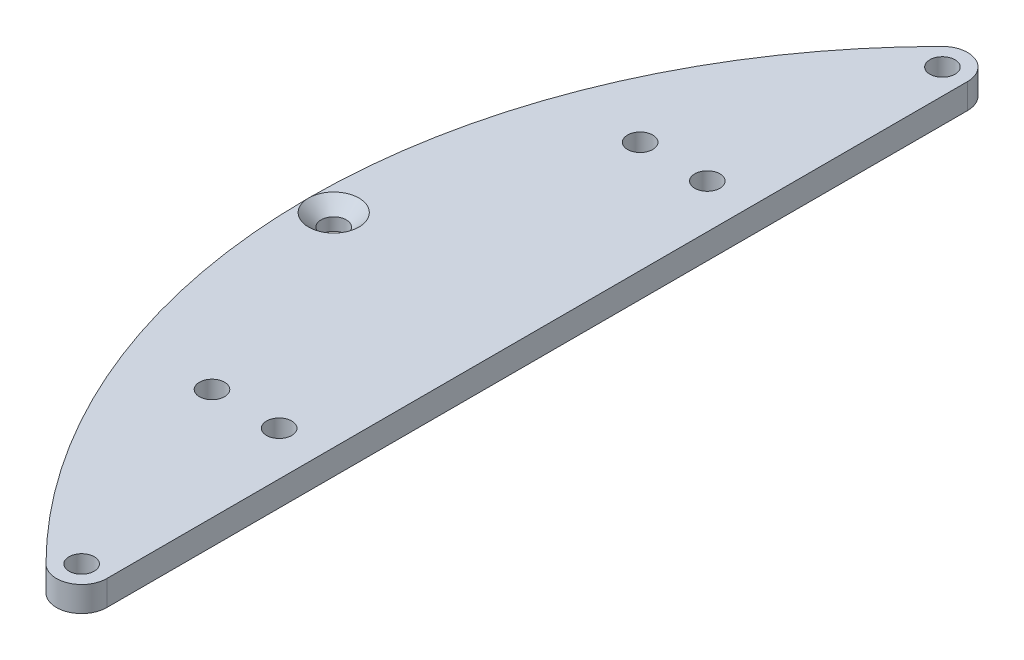
from build123d import *

# Parameters (mm, degrees)
SKETCH_1_R      = 1.5
EXTRUDE_1_DEPTH = 3
CHAMFER_1_SIZE  = 1.5


with BuildPart() as part:
    # 草图1 → 凸台-拉伸1 (new body)
    with BuildSketch(Plane(origin=(0, 0, 0), x_dir=(1, 0, 0), z_dir=(0, 1, 0))):
        with BuildLine():
            Line((-48.265241636, 51.265241636), (-48.265241636, -51.265241636))
            ThreePointArc((-48.265241636, -51.265241636), (-50.117191339, -54.036880234), (-53.38656198, -53.38656198))
            ThreePointArc((-53.38656198, -53.38656198), (-75.5, 0), (-53.38656198, 53.38656198))
            ThreePointArc((-53.38656198, 53.38656198), (-50.117191339, 54.036880234), (-48.265241636, 51.265241636))
        make_face()
        with Locations(Location((-51.265241636, -51.265241636, 0), (0, 0, 270))):
            Circle(SKETCH_1_R, mode=Mode.SUBTRACT)
        with Locations(Location((-72.5, 0, 0), (0, 0, 270))):
            Circle(SKETCH_1_R, mode=Mode.SUBTRACT)
        with Locations(Location((-51.265241636, 51.265241636, 0), (0, 0, 270))):
            Circle(SKETCH_1_R, mode=Mode.SUBTRACT)
        with Locations(Location((-61.499999084, -25.5, 0), (0, 0, 270))):
            Circle(SKETCH_1_R, mode=Mode.SUBTRACT)
        with Locations(Location((-53.499999084, -25.5, 0), (0, 0, 270))):
            Circle(SKETCH_1_R, mode=Mode.SUBTRACT)
        with Locations(Location((-61.499999084, 25.5, 0), (0, 0, 270))):
            Circle(SKETCH_1_R, mode=Mode.SUBTRACT)
        with Locations(Location((-53.499999084, 25.5, 0), (0, 0, 270))):
            Circle(SKETCH_1_R, mode=Mode.SUBTRACT)
    extrude(amount=EXTRUDE_1_DEPTH)

    # 倒角1
    chamfer_1_edges = [part.edges().sort_by_distance(p)[0] for p in [
        (-72.5, 3, -1.5),
    ]]
    chamfer(chamfer_1_edges, length=CHAMFER_1_SIZE - 0.0001)  # a hair under: the kernel refuses the full size


solid = part.part
